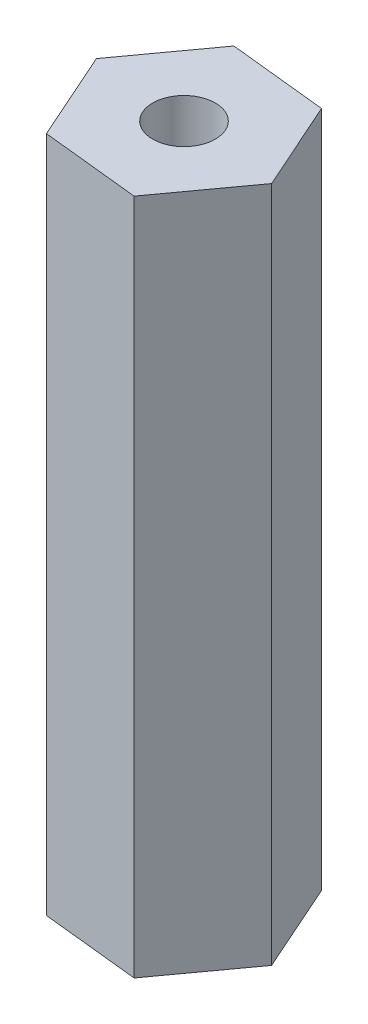
from build123d import *

# Parameters (mm, degrees)
SKETCH1_R           = 1.25
BOSS_EXTRUDE1_DEPTH = 27


with BuildPart() as part:
    # Sketch1 → Boss-Extrude1 (new body)
    with BuildSketch(Plane(origin=(0, 0, 0), x_dir=(1, 0, 0), z_dir=(0, 1, 0))):
        Polygon((2.307316277, 3.176622058), (-1.597377262, 3.586505539), (-3.904693539, 0.409883482), (-2.307316277, -3.176622058), (1.597377262, -3.586505539), (3.904693539, -0.409883482), align=None)
        Circle(SKETCH1_R, mode=Mode.SUBTRACT)
    extrude(amount=BOSS_EXTRUDE1_DEPTH)


solid = part.part
